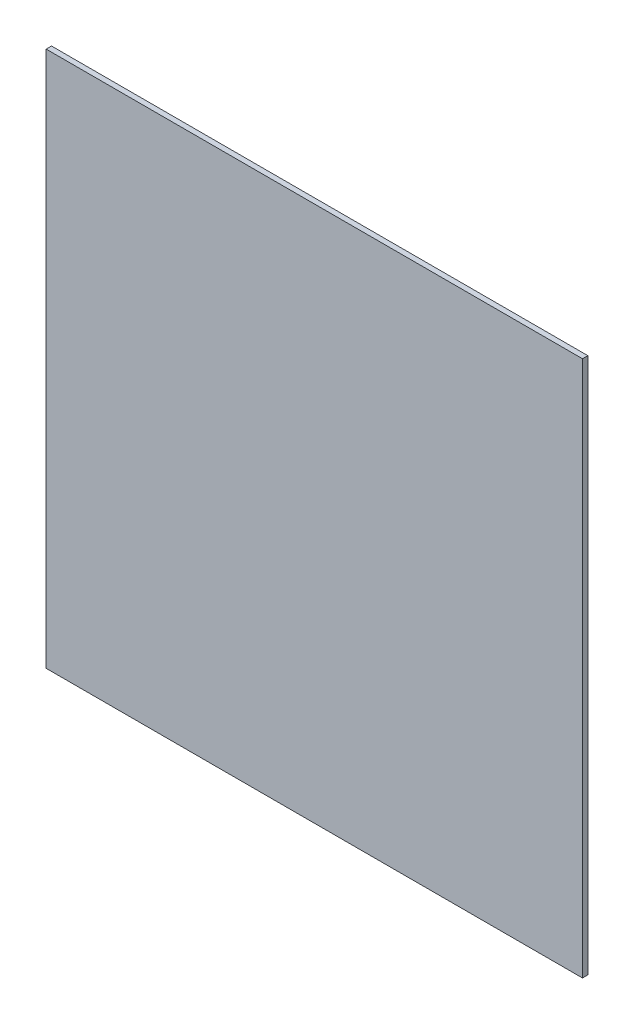
from build123d import *

# Parameters (mm, degrees)
SKETCH1_W           = 20000
SKETCH1_H           = 20000
BOSS_EXTRUDE1_DEPTH = 200


with BuildPart() as part:
    # Sketch1 → Boss-Extrude1 (new body)
    with BuildSketch(Plane.XY):
        Rectangle(SKETCH1_W, SKETCH1_H)
    extrude(amount=-BOSS_EXTRUDE1_DEPTH)


solid = part.part
